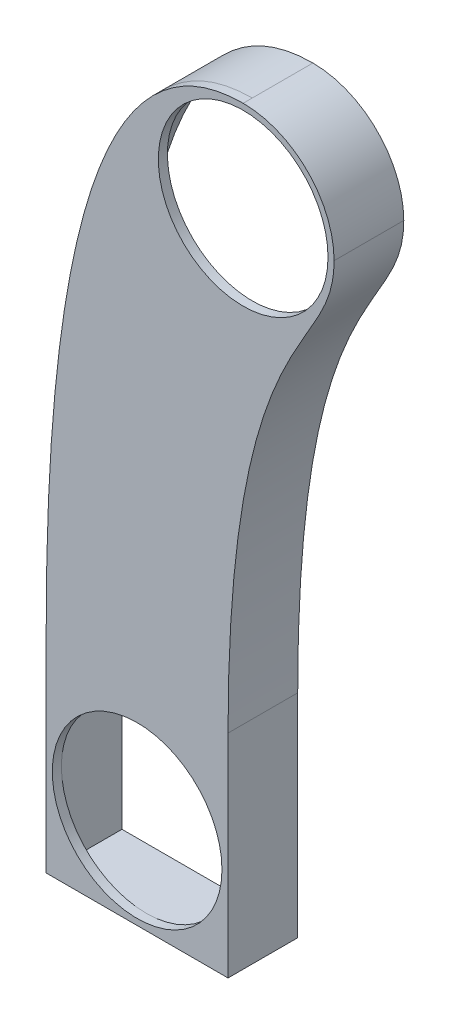
from build123d import *

# Parameters (mm, degrees)
BOSS_EXTRUDE1_OUTLINE_R = 28
BOSS_EXTRUDE1_DEPTH     = 3
BOSS_EXTRUDE3_START     = 20
BOSS_EXTRUDE3_DEPTH     = 20


# Read off the part's stored shape, not the designer's step: Boss-Extrude1
with BuildPart() as part:
    # Boss-Extrude1 outline → Boss-Extrude1 (new body)
    with BuildSketch(Plane.XY):
        with BuildLine():
            Line((30, -70), (30, 0))
            add(Edge.make_bspline(
                [(30, 0), (30, 122.919601085), (65, 122.919601085), (65, 152.5)],
                knots=[0, 0, 0, 0, 1, 1, 1, 1], degree=3))
            ThreePointArc((65, 152.5), (56.213203436, 173.713203436), (35, 182.5))
            add(Edge.make_bspline(
                [(-30, 0), (-30, 182.5), (35, 182.5)],
                knots=[0, 0, 0, 1, 1, 1], degree=2))
            Line((-30, 0), (-30, -70))
            Line((-30, -70), (30, -70))
        make_face()
        with Locations((0, -40)):
            Circle(BOSS_EXTRUDE1_OUTLINE_R, mode=Mode.SUBTRACT)
        with Locations((35, 152.5)):
            Circle(BOSS_EXTRUDE1_OUTLINE_R, mode=Mode.SUBTRACT)
    extrude(amount=BOSS_EXTRUDE1_DEPTH)

    # Sketch3 → Boss-Extrude3 (add)
    with BuildSketch(Plane(origin=(0, 0, 0), x_dir=(-1, 0, 0), z_dir=(0, 0, -1)).offset(BOSS_EXTRUDE3_START)):
        with BuildLine():
            Line((-30, 0), (-30, -70))
            Line((-30, -70), (30, -70))
            Line((30, -70), (30, 0))
            add(Edge.make_bspline(
                [(30, 0), (30, 182.5), (-35, 182.5)],
                knots=[0, 0, 0, 1, 1, 1], degree=2))
            ThreePointArc((-35, 182.5), (-56.213203436, 173.713203436), (-65, 152.5))
            add(Edge.make_bspline(
                [(-65, 152.5), (-65, 122.919601085), (-30, 122.919601085), (-30, 0)],
                knots=[0, 0, 0, 0, 1, 1, 1, 1], degree=3))
        make_face()
        with BuildLine():
            Line((-28, 0), (-28, -68))
            Line((-28, -68), (28, -68))
            Line((28, -68), (28, 0))
            add(Edge.make_bspline(
                [(28, 0), (28, 1.882428306), (27.9894412, 5.668914661), (27.926096555, 13.06867177), (27.76775639, 22.113138456), (27.45115367, 32.600472774), (26.860323994, 46.108658024), (25.805698034, 62.096829622), (24.035349894, 79.847577378), (21.76158749, 96.16063855), (18.061595292, 115.991158762), (12.190733374, 137.171036702), (3.196896645, 156.784444582), (-5.834661566, 168.281935437), (-13.924397363, 174.636152769), (-19.34693601, 177.454327423), (-23.921129202, 179.03154511), (-27.474819646, 179.877405657), (-30.546503211, 180.301515997), (-33.065469046, 180.471580895), (-34.357731157, 180.5), (-35, 180.5)],
                knots=[0.49382409, 0.49382409, 0.49382409, 0.49382409, 0.49393283, 0.494041569, 0.494259049, 0.494476528, 0.494694008, 0.495128967, 0.495563926, 0.495998885, 0.496433844, 0.497303761, 0.498173679, 0.499043597, 0.499478556, 0.499913515, 0.500130995, 0.500348474, 0.500565954, 0.500674693, 0.500783433, 0.500783433, 0.500783433, 0.500783433], degree=3))
            ThreePointArc((-35, 180.5), (-54.798989873, 172.298989873), (-63, 152.5))
            add(Edge.make_bspline(
                [(-63, 152.5), (-63, 152.069757812), (-62.983825045, 151.199286285), (-62.88918488, 149.540019878), (-62.658452593, 147.549741818), (-62.213886299, 145.2784002), (-61.410812146, 142.352354087), (-60.033210568, 138.80365362), (-57.846222702, 134.475175879), (-55.208976195, 129.863823008), (-51.231452034, 123.063969133), (-46.792456906, 114.875371889), (-42.352360132, 104.461715313), (-39.130632465, 95.326409045), (-36.123020534, 84.651250359), (-33.432349584, 72.218369024), (-31.538773259, 60.209244421), (-30.283559802, 49.501788472), (-29.484585221, 40.893227078), (-28.840668199, 31.678686061), (-28.443815603, 23.471810433), (-28.216507678, 16.574966065), (-28.092697498, 11.23438398), (-28.029735078, 6.636857178), (-28.004285655, 2.878237886), (-28, 0.955822894), (-28, 0)],
                knots=[0, 0, 0, 0, 0.015625, 0.03125, 0.0625, 0.09375, 0.125, 0.1875, 0.25, 0.3125, 0.375, 0.5, 0.5625, 0.625, 0.6875, 0.75, 0.8125, 0.84375, 0.875, 0.90625, 0.9375, 0.953125, 0.96875, 0.984375, 0.9921875, 1, 1, 1, 1], degree=3))
        make_face(mode=Mode.SUBTRACT)
    extrude(amount=-BOSS_EXTRUDE3_DEPTH)


solid = part.part
